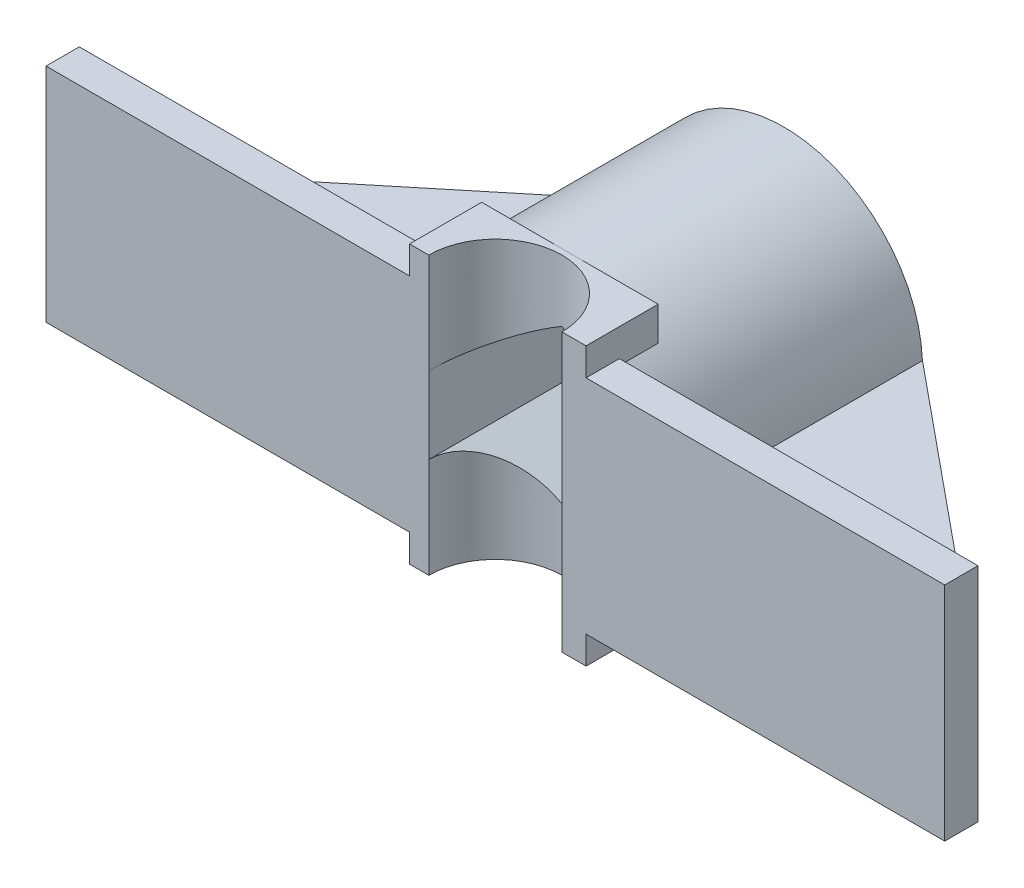
from build123d import *

# Parameters (mm, degrees)
SKETCH1_W                = 162
SKETCH1_H                = 40
BOSS_EXTRUDE1_DEPTH      = 6
BOSS_EXTRUDE2_START      = -20
SKETCH2_W                = 31.820776168
SKETCH2_H                = 13
BOSS_EXTRUDE2_DEPTH      = 25
CUT_EXTRUDE1_DEPTH       = 97.072888996
BOSS_EXTRUDE3_DEPTH      = 39
BOSS_EXTRUDE3_DEPTH_BACK = 7
SKETCH4_R                = 25
SKETCH5_R                = 12
CUT_EXTRUDE3_DEPTH       = 109.466584762
CUT_EXTRUDE4_DEPTH       = 100.448479124
RIB5_START               = -1
RIB5_DEPTH               = 2


with BuildPart() as part:
    # Sketch1 → Boss-Extrude1 (new body)
    with BuildSketch(Plane.XY):
        Rectangle(SKETCH1_W, SKETCH1_H)
    extrude(amount=-BOSS_EXTRUDE1_DEPTH)

    # Sketch2 → Boss-Extrude2 (add)
    with BuildSketch(Plane(origin=(0, 20, 0), x_dir=(1, 0, 0), z_dir=(0, 1, 0)).offset(BOSS_EXTRUDE2_START)):
        with Locations((0.439513483, 6.5)):
            Rectangle(SKETCH2_W, SKETCH2_H)
    boss_extrude2 = extrude(amount=BOSS_EXTRUDE2_DEPTH)

    # Mirror1: Boss-Extrude2 across plane
    add(boss_extrude2.mirror(Plane.ZX))

    # Sketch3 → Cut-Extrude1 (cut, through all)
    with BuildSketch(Plane(origin=(0, 25, 0), x_dir=(1, 0, 0), z_dir=(0, 1, 0))):
        with BuildLine():
            Line((-12, 0), (12, 0))
            ThreePointArc((12, 0), (0, 12), (-12, 0))
        make_face()
    extrude(amount=-CUT_EXTRUDE1_DEPTH, mode=Mode.SUBTRACT)

    # Sketch4 → Boss-Extrude3 (add, two sides: drawn at the far end of the back side and taken through both)
    with BuildSketch(Plane(origin=(0, 0, -13), x_dir=(-1, 0, 0), z_dir=(0, 0, -1)).offset(-BOSS_EXTRUDE3_DEPTH_BACK)):
        Circle(SKETCH4_R)
    extrude(amount=BOSS_EXTRUDE3_DEPTH + BOSS_EXTRUDE3_DEPTH_BACK)

    # Sketch5 → Cut-Extrude3 (cut, through all)
    with BuildSketch(Plane.XZ.offset(25)):
        Circle(SKETCH5_R)
    extrude(amount=-CUT_EXTRUDE3_DEPTH, mode=Mode.SUBTRACT)

    # Sketch6 → Cut-Extrude4 (cut, through all)
    with BuildSketch(Plane(origin=(0, 0, -52), x_dir=(-1, 0, 0), z_dir=(0, 0, -1))):
        Polygon((0, 13.856406461), (-12, 6.92820323), (-12, -6.92820323), (0, -13.856406461), (12, -6.92820323), (12, 6.92820323), align=None)
    extrude(amount=-CUT_EXTRUDE4_DEPTH, mode=Mode.SUBTRACT)

    # Rib5: read off the stored shape, not the designer's step
    # Rib5 outline → Rib5 (add)
    with BuildSketch(Plane(origin=(0, 0, 0), x_dir=(1, 0, 0), z_dir=(0, 1, 0)).offset(RIB5_START)):
        Polygon((81, 6), (25, 52), (24.979991994, 52), (24.979991994, 6), align=None)
    rib5 = extrude(amount=RIB5_DEPTH)

    # Mirror2: Rib5 across plane
    add(rib5.mirror(Plane(origin=(0, 0, 0), x_dir=(0, 0, 1), z_dir=(1, 0, 0))))


solid = part.part
